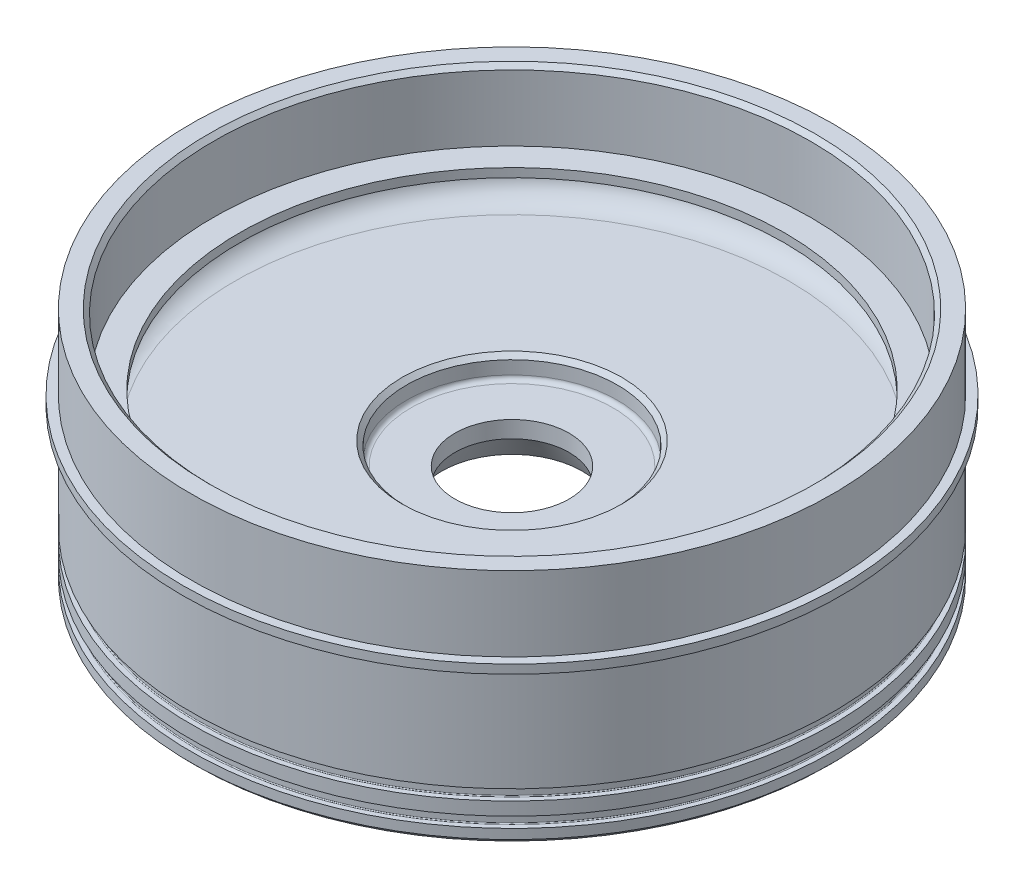
from build123d import *

# Parameters (mm, degrees)
SCHIZZO1_W    = 11
SCHIZZO1_H    = 5
SCHIZZO1_W_2  = 2
SCHIZZO1_H_2  = 2
SCHIZZO1_W_3  = 6
SMUSSO1_SIZE  = 3
SMUSSO1_SIZE2 = 5.196152423
SMUSSO2_SIZE  = 1
RACCORDO1_R   = 26
SMUSSO3_SIZE  = 1
RACCORDO2_R   = 0.2
SCHIZZO2_W    = 11
SCHIZZO2_H    = 5
RACCORDO3_R   = 1
SMUSSO4_SIZE  = 1
RACCORDO4_R   = 5
SMUSSO5_SIZE  = 1


with BuildPart() as part:
    # Schizzo1 → Rivoluzione1 (revolve)
    with BuildSketch(Plane.XY, mode=Mode.PRIVATE) as rivoluzione1_sk:
        Polygon((-13, 9), (-13, 0), (-73, 0), (-73, 14), (-24, 14), (-24, 9), align=None)
        with Locations((-18.5, 11.5)):
            Rectangle(SCHIZZO1_W, SCHIZZO1_H)
        Polygon((-73, 21), (-73, 14), (-68, 14), (-68, 22), (-68, 24), (-68, 40), (-73, 40), (-73, 23), align=None)
        Polygon((-69, -14), (-69, 0), (-73, 0), (-73, -3), (-71.7, -3), (-71.7, -5.4), (-73, -5.4), (-73, -8.4), (-71.7, -8.4), (-71.7, -10.8), (-73, -10.8), (-73, -14), align=None)
        with Locations((-74, 22)):
            Rectangle(SCHIZZO1_W_2, SCHIZZO1_H_2)
        with Locations((-65, 23)):
            Rectangle(SCHIZZO1_W_3, SCHIZZO1_H_2)
    revolve(rivoluzione1_sk.sketch.rotate(Axis((0, 0, 0), (0, 1, 0)), 270), axis=Axis((0, 0, 0), (0, 1, 0)))

    # Smusso1
    smusso1_edges = [part.edges().sort_by_distance(p)[0] for p in [
        (0, 0, 13),
    ]]
    smusso1_side = [part.faces().sort_by_distance(p)[0] for p in [
        (0, 0, 67.048385284),
    ]]
    chamfer(smusso1_edges, length=SMUSSO1_SIZE, length2=SMUSSO1_SIZE2, reference=smusso1_side[0])

    # Smusso2
    smusso2_edges = [part.edges().sort_by_distance(p)[0] for p in [
        (0, -14, 69),
    ]]
    chamfer(smusso2_edges, length=SMUSSO2_SIZE)

    # Raccordo1
    # the kernel refuses this fillet: 26 mm, written as the material it adds along each edge
    with BuildSketch(Plane(origin=(0, 0, 0), x_dir=(0, 0, -1), z_dir=(1, 0, 0))) as raccordo1_piece_1:
        with BuildLine():
            CenterArc((46.483339502, -26), RACCORDO1_R, 30, 60)
            Line((46.483339502, 0), (46.483339502, 0.52))
            Line((46.483339502, 0.52), (69, 0.52))
            Line((69, 0.52), (69.52, 0))
            ThreePointArc((69.52, 0), (69.52, -6.5), (69.45033321, -12.74))
            Line((69.45033321, -12.74), (69, -13))
        make_face()
    revolve(axis=Axis((0, 0, 0), (0, 1, 0)))

    # Smusso3
    smusso3_edges = [part.edges().sort_by_distance(p)[0] for p in [
        (0, 40, 68),
    ]]
    chamfer(smusso3_edges, length=SMUSSO3_SIZE)

    # Raccordo2
    raccordo2_edges = [part.edges().sort_by_distance(p)[0] for p in [
        (0, -10.8, 71.7),
        (0, -8.4, 71.7),
        (0, -5.4, 71.7),
        (0, -3, 71.7),
    ]]
    fillet(raccordo2_edges, radius=RACCORDO2_R)

    # Schizzo2 → Taglia-Rivoluzione1 (revolve, cut)
    with BuildSketch(Plane.XY, mode=Mode.PRIVATE) as taglia_rivoluzione1_sk:
        with Locations((-18.5, 11.5)):
            Rectangle(SCHIZZO2_W, SCHIZZO2_H)
    revolve(taglia_rivoluzione1_sk.sketch.rotate(Axis((0, 0, 0), (0, 1, 0)), 90), axis=Axis((0, 0, 0), (0, 1, 0)), mode=Mode.SUBTRACT)

    # Raccordo3
    raccordo3_edges = [part.edges().sort_by_distance(p)[0] for p in [
        (0, 9, -24),
    ]]
    fillet(raccordo3_edges, radius=RACCORDO3_R)

    # Smusso4
    smusso4_edges = [part.edges().sort_by_distance(p)[0] for p in [
        (0, 14, -24),
    ]]
    chamfer(smusso4_edges, length=SMUSSO4_SIZE)

    # Raccordo4
    raccordo4_edges = [part.edges().sort_by_distance(p)[0] for p in [
        (0, 14, 68),
    ]]
    fillet(raccordo4_edges, radius=RACCORDO4_R)

    # Smusso5
    smusso5_edges = [part.edges().sort_by_distance(p)[0] for p in [
        (0, -14, 73),
    ]]
    chamfer(smusso5_edges, length=SMUSSO5_SIZE)


solid = part.part
